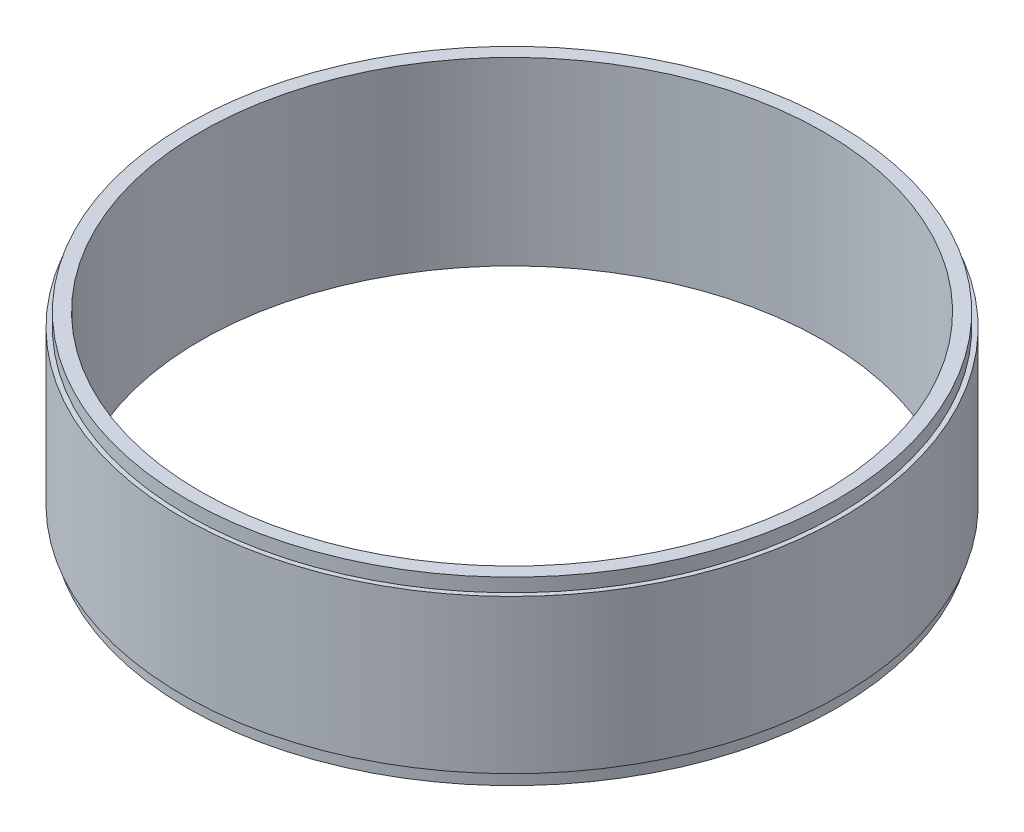
from build123d import *


with BuildPart() as part:
    # Schizzo1 → Rivoluzione1 (revolve)
    with BuildSketch(Plane.XY):
        Polygon((-69, 0), (-69, 6.892279191), (-69, 40), (-72, 40), (-72, 37), (-73, 37), (-73, 3), (-72, 3), (-72, 0), align=None)
    revolve(axis=Axis((0, 0, 0), (0, 1, 0)))


solid = part.part
